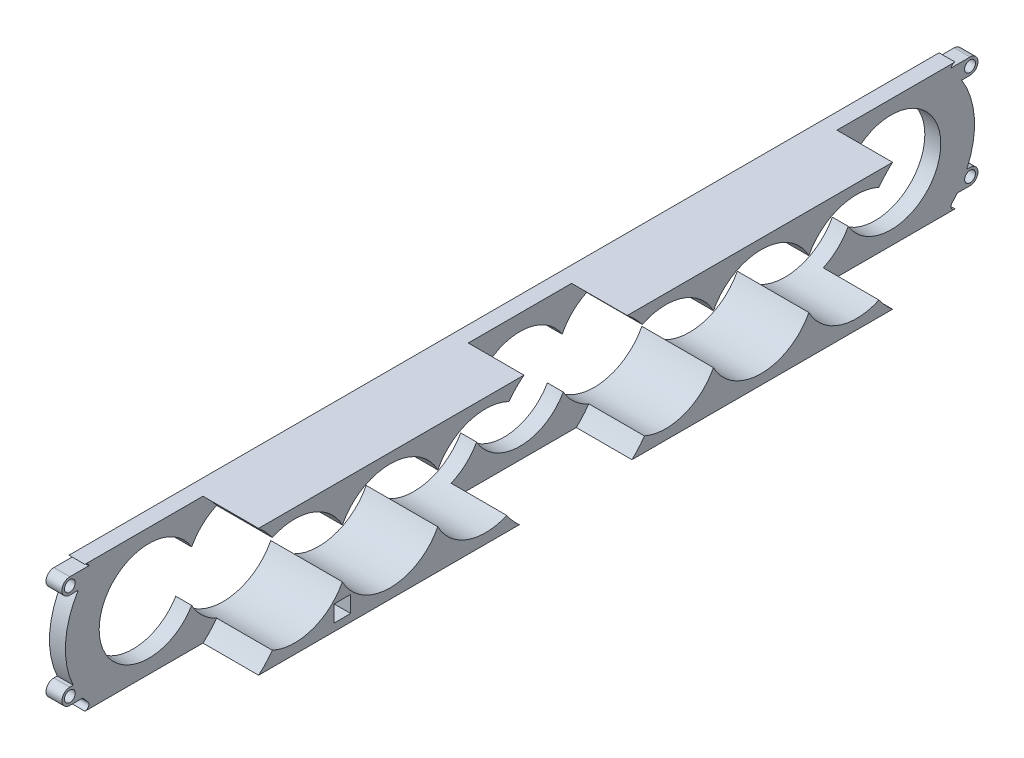
from build123d import *

# Parameters (mm, degrees)
SKETCH1_W           = 368.3
SKETCH1_H           = 50.8
BOSS_EXTRUDE1_DEPTH = 28.575
CHAMFER1_SIZE       = 6.35
FILLET1_R           = 3.175
SKETCH2_R           = 33.3375
CUT_EXTRUDE1_DEPTH  = 22.225
CUT_EXTRUDE2_REACH  = 190.186
CUT_EXTRUDE3_REACH  = 190.186
SKETCH5_W           = 6.604
SKETCH5_H           = 6.604
FILLET2_R           = 1.5875
CAVITY1_START       = 6.35
CAVITY1_OUTLINE_R   = 1.905
CAVITY1_DEPTH       = 22.225
CAVITY1_2_DEPTH     = 6.35
CUT_EXTRUDE4_REACH  = 188.943
SKETCH7_R           = 2.159


# Read off the part's stored shape, not the designer's step: Cavity1
with BuildPart() as part:
    # Sketch1 → Boss-Extrude1 (new body)
    with BuildSketch(Plane(origin=(0, 0, 0), x_dir=(0, 0, -1), z_dir=(1, 0, 0))):
        with Locations((0, 0.79375)):
            Rectangle(SKETCH1_W, SKETCH1_H)
    extrude(amount=BOSS_EXTRUDE1_DEPTH)

    # Chamfer1
    chamfer1_edges = [part.edges().sort_by_distance(p)[0] for p in [
        (14.2875, -24.60625, 184.15),
        (14.2875, -24.60625, -184.15),
    ]]
    chamfer(chamfer1_edges, length=CHAMFER1_SIZE)

    # Fillet1
    fillet1_edges = [part.edges().sort_by_distance(p)[0] for p in [
        (14.2875, -18.25625, -184.15),
        (14.2875, -24.60625, 177.8),
        (14.2875, -24.60625, -177.8),
        (14.2875, -18.25625, 184.15),
        (14.2875, 26.19375, 184.15),
        (14.2875, 26.19375, -184.15),
    ]]
    fillet(fillet1_edges, radius=FILLET1_R)

    # Sketch2 → Cut-Extrude1 (cut)
    with BuildSketch(Plane(origin=(28.575, 0, 0), x_dir=(0, 0, -1), z_dir=(1, 0, 0))):
        with Locations((-148.157911006, 0.79375)):
            Circle(SKETCH2_R)
        Circle(SKETCH2_R)
        with Locations((148.157911006, 0.79375)):
            Circle(SKETCH2_R)
    extrude(amount=-CUT_EXTRUDE1_DEPTH, mode=Mode.SUBTRACT)

    # Sketch4 → Cut-Extrude2 (cut, up to next)
    with BuildSketch(Plane(origin=(28.575, 0, 0), x_dir=(0, 0, -1), z_dir=(1, 0, 0)), mode=Mode.PRIVATE) as cut_extrude2_sk1:
        with BuildLine():
            ThreePointArc((-131.07672228, 10.893621573), (-168.001661006, 0.79375), (-131.07672228, -9.306121573))
            ThreePointArc((-131.07672228, -9.306121573), (-112.015493633, -20.636909552), (-93.124577673, -9.024395271))
            ThreePointArc((-93.124577673, -9.024395271), (-74.074577673, -20.6375), (-55.024577673, -9.024395271))
            ThreePointArc((-55.024577673, -9.024395271), (-36.370033983, -20.633851146), (-17.299823722, -9.720623089))
            ThreePointArc((-17.299823722, -9.720623089), (0, -19.84375), (17.299823722, -9.720623089))
            ThreePointArc((17.299823722, -9.720623089), (36.370033983, -20.633851146), (55.024577673, -9.024395271))
            ThreePointArc((55.024577673, -9.024395271), (74.074577673, -20.6375), (93.124577673, -9.024395271))
            ThreePointArc((93.124577673, -9.024395271), (112.015493633, -20.636909552), (131.07672228, -9.306121573))
            ThreePointArc((131.07672228, -9.306121573), (168.001661006, 0.79375), (131.07672228, 10.893621573))
            ThreePointArc((131.07672228, 10.893621573), (112.015493633, 22.224409552), (93.124577673, 10.611895271))
            ThreePointArc((93.124577673, 10.611895271), (74.074577673, 22.225), (55.024577673, 10.611895271))
            ThreePointArc((55.024577673, 10.611895271), (35.897270086, 22.224860566), (16.854241153, 10.474204945))
            ThreePointArc((16.854241153, 10.474204945), (0, 19.84375), (-16.854241153, 10.474204945))
            ThreePointArc((-16.854241153, 10.474204945), (-35.897270086, 22.224860566), (-55.024577673, 10.611895271))
            ThreePointArc((-55.024577673, 10.611895271), (-74.074577673, 22.225), (-93.124577673, 10.611895271))
            ThreePointArc((-93.124577673, 10.611895271), (-112.015493633, 22.224409552), (-131.07672228, 10.893621573))
        make_face()
    cut_extrude2_tool1 = extrude(cut_extrude2_sk1.sketch, amount=-CUT_EXTRUDE2_REACH, mode=Mode.PRIVATE) & part.part
    add(cut_extrude2_tool1.solids().sort_by_distance((28.575, 0.715797, 0))[0], mode=Mode.SUBTRACT)

    # Sketch5 → Cut-Extrude3 (cut, up to next)
    with BuildSketch(Plane(origin=(28.575, 0, 0), x_dir=(0, 0, -1), z_dir=(1, 0, 0)), mode=Mode.PRIVATE) as cut_extrude3_sk1:
        with Locations((-93.124577673, -18.322281394)):
            Rectangle(SKETCH5_W, SKETCH5_H)
    cut_extrude3_tool1 = extrude(cut_extrude3_sk1.sketch, amount=-CUT_EXTRUDE3_REACH, mode=Mode.PRIVATE) & part.part
    add(cut_extrude3_tool1.solids().sort_by_distance((28.575, -18.322281, 93.124578))[0], mode=Mode.SUBTRACT)

    # Fillet2
    fillet2_edges = [part.edges().sort_by_distance(p)[0] for p in [
        (17.4625, -24.60625, -169.750245438),
        (17.4625, 26.19375, -169.750245438),
        (17.4625, -24.60625, 169.750245438),
        (17.4625, 26.19375, 169.750245438),
    ]]
    fillet(fillet2_edges, radius=FILLET2_R)

    # Cavity1 outline → Cavity1 (cut)
    # profile 1 of 2: a face of its own
    with BuildSketch(Plane.YZ.offset(CAVITY1_START)):
        with BuildLine():
            ThreePointArc((-21.936363636, 172.545014982), (-20.786227921, 173.568410001), (-19.590070715, 174.537614554))
            ThreePointArc((-19.590070715, 174.537614554), (-16.522960019, 176.64510919), (-13.240070715, 178.397632936))
            ThreePointArc((-13.240070715, 178.397632936), (2.926403377, 181.427126443), (18.57375, 176.358274589))
            ThreePointArc((18.57375, 176.358274589), (21.138345447, 174.567877729), (23.523863636, 172.545014982))
            ThreePointArc((23.523863636, 172.545014982), (24.176019306, 172.178216056), (24.92375, 172.150879661))
            ThreePointArc((24.92375, 172.150879661), (25.835922212, 172.70228249), (26.19375, 173.706305647))
            Line((26.19375, 173.706305647), (26.19375, 180.975))
            ThreePointArc((26.19375, 180.975), (25.26381403, 183.22006403), (23.01875, 184.15))
            Line((23.01875, 184.15), (-16.941121939, 184.15))
            ThreePointArc((-16.941121939, 184.15), (-18.156141837, 183.908317516), (-19.18618597, 183.22006403))
            Line((-19.18618597, 183.22006403), (-23.67631403, 178.72993597))
            ThreePointArc((-23.67631403, 178.72993597), (-24.364567516, 177.699891837), (-24.60625, 176.484871939))
            Line((-24.60625, 176.484871939), (-24.60625, 173.706305647))
            ThreePointArc((-24.60625, 173.706305647), (-23.651943453, 172.250550757), (-21.936363636, 172.545014982))
        make_face()
        with Locations((-16.415070715, 179.705)):
            Circle(CAVITY1_OUTLINE_R, mode=Mode.SUBTRACT)
        with Locations((21.74875, 179.705)):
            Circle(CAVITY1_OUTLINE_R, mode=Mode.SUBTRACT)
    # profile 2 of 2: a face of its own
    with BuildSketch(Plane.YZ.offset(CAVITY1_START)):
        with BuildLine():
            ThreePointArc((-21.936363636, -172.545014982), (-23.651943453, -172.250550757), (-24.60625, -173.706305647))
            Line((-24.60625, -173.706305647), (-24.60625, -176.484871939))
            ThreePointArc((-24.60625, -176.484871939), (-24.364567516, -177.699891837), (-23.67631403, -178.72993597))
            Line((-23.67631403, -178.72993597), (-19.18618597, -183.22006403))
            ThreePointArc((-19.18618597, -183.22006403), (-18.156141837, -183.908317516), (-16.941121939, -184.15))
            Line((-16.941121939, -184.15), (23.01875, -184.15))
            ThreePointArc((23.01875, -184.15), (25.26381403, -183.22006403), (26.19375, -180.975))
            Line((26.19375, -180.975), (26.19375, -173.706305647))
            ThreePointArc((26.19375, -173.706305647), (25.835922212, -172.70228249), (24.92375, -172.150879661))
            ThreePointArc((24.92375, -172.150879661), (24.176019306, -172.178216056), (23.523863636, -172.545014982))
            ThreePointArc((23.523863636, -172.545014982), (21.138345447, -174.567877729), (18.57375, -176.358274589))
            ThreePointArc((18.57375, -176.358274589), (2.926403377, -181.427126443), (-13.240070715, -178.397632935))
            ThreePointArc((-13.240070715, -178.397632935), (-16.522960019, -176.64510919), (-19.590070715, -174.537614554))
            ThreePointArc((-19.590070715, -174.537614554), (-20.786227921, -173.568410001), (-21.936363636, -172.545014982))
        make_face()
        with Locations((-16.415070715, -179.705)):
            Circle(CAVITY1_OUTLINE_R, mode=Mode.SUBTRACT)
        with Locations((21.74875, -179.705)):
            Circle(CAVITY1_OUTLINE_R, mode=Mode.SUBTRACT)
    extrude(amount=CAVITY1_DEPTH, mode=Mode.SUBTRACT)

    # Cavity1 2 outline → Cavity1 2 (cut)
    with BuildSketch(Plane.YZ):
        with BuildLine():
            Line((-13.240070715, 179.705), (-13.240070715, 178.397632935))
            ThreePointArc((-13.240070715, 178.397632935), (2.926403377, 181.427126443), (18.57375, 176.358274589))
            Line((18.57375, 176.358274589), (18.57375, 179.705))
            ThreePointArc((18.57375, 179.705), (21.74875, 182.88), (24.92375, 179.705))
            Line((24.92375, 179.705), (24.92375, 172.150879661))
            ThreePointArc((24.92375, 172.150879661), (25.835922212, 172.70228249), (26.19375, 173.706305647))
            Line((26.19375, 173.706305647), (26.19375, 180.975))
            ThreePointArc((26.19375, 180.975), (25.26381403, 183.22006403), (23.01875, 184.15))
            Line((23.01875, 184.15), (-16.941121939, 184.15))
            ThreePointArc((-16.941121939, 184.15), (-18.156141837, 183.908317516), (-19.18618597, 183.22006403))
            Line((-19.18618597, 183.22006403), (-23.67631403, 178.72993597))
            ThreePointArc((-23.67631403, 178.72993597), (-24.364567516, 177.699891837), (-24.60625, 176.484871939))
            Line((-24.60625, 176.484871939), (-24.60625, 173.706305647))
            ThreePointArc((-24.60625, 173.706305647), (-23.651943453, 172.250550757), (-21.936363636, 172.545014982))
            ThreePointArc((-21.936363636, 172.545014982), (-20.786227921, 173.568410001), (-19.590070715, 174.537614554))
            Line((-19.590070715, 174.537614554), (-19.590070715, 179.705))
            ThreePointArc((-19.590070715, 179.705), (-16.415070715, 182.88), (-13.240070715, 179.705))
        make_face()
        with BuildLine():
            ThreePointArc((-21.936363636, -172.545014982), (-23.651943453, -172.250550757), (-24.60625, -173.706305647))
            Line((-24.60625, -173.706305647), (-24.60625, -176.484871939))
            ThreePointArc((-24.60625, -176.484871939), (-24.364567516, -177.699891837), (-23.67631403, -178.72993597))
            Line((-23.67631403, -178.72993597), (-19.18618597, -183.22006403))
            ThreePointArc((-19.18618597, -183.22006403), (-18.156141837, -183.908317516), (-16.941121939, -184.15))
            Line((-16.941121939, -184.15), (23.01875, -184.15))
            ThreePointArc((23.01875, -184.15), (25.26381403, -183.22006403), (26.19375, -180.975))
            Line((26.19375, -180.975), (26.19375, -173.706305647))
            ThreePointArc((26.19375, -173.706305647), (25.835922212, -172.70228249), (24.92375, -172.150879661))
            Line((24.92375, -172.150879661), (24.92375, -179.705))
            ThreePointArc((24.92375, -179.705), (21.74875, -182.88), (18.57375, -179.705))
            Line((18.57375, -179.705), (18.57375, -176.358274589))
            ThreePointArc((18.57375, -176.358274589), (2.926403377, -181.427126443), (-13.240070715, -178.397632935))
            Line((-13.240070715, -178.397632935), (-13.240070715, -179.705))
            ThreePointArc((-13.240070715, -179.705), (-16.415070715, -182.88), (-19.590070715, -179.705))
            Line((-19.590070715, -179.705), (-19.590070715, -174.537614554))
            ThreePointArc((-19.590070715, -174.537614554), (-20.786227921, -173.568410001), (-21.936363636, -172.545014982))
        make_face()
    extrude(amount=CAVITY1_2_DEPTH, mode=Mode.SUBTRACT)

    # Sketch7 → Cut-Extrude4 (cut, up to next)
    with BuildSketch(Plane(origin=(28.575, 0, 0), x_dir=(0, 0, -1), z_dir=(1, 0, 0)), mode=Mode.PRIVATE) as cut_extrude4_sk1:
        with Locations((-179.705, 21.74875)):
            Circle(SKETCH7_R)
    cut_extrude4_tool1 = extrude(cut_extrude4_sk1.sketch, amount=-CUT_EXTRUDE4_REACH, mode=Mode.PRIVATE) & part.part
    # Sketch7 → Cut-Extrude4 (cut, up to next)
    with BuildSketch(Plane(origin=(28.575, 0, 0), x_dir=(0, 0, -1), z_dir=(1, 0, 0)), mode=Mode.PRIVATE) as cut_extrude4_sk2:
        with Locations((-179.705, -16.415070715)):
            Circle(SKETCH7_R)
    cut_extrude4_tool2 = extrude(cut_extrude4_sk2.sketch, amount=-CUT_EXTRUDE4_REACH, mode=Mode.PRIVATE) & part.part
    # Sketch7 → Cut-Extrude4 (cut, up to next)
    with BuildSketch(Plane(origin=(28.575, 0, 0), x_dir=(0, 0, -1), z_dir=(1, 0, 0)), mode=Mode.PRIVATE) as cut_extrude4_sk3:
        with Locations((179.705, 21.74875)):
            Circle(SKETCH7_R)
    cut_extrude4_tool3 = extrude(cut_extrude4_sk3.sketch, amount=-CUT_EXTRUDE4_REACH, mode=Mode.PRIVATE) & part.part
    # Sketch7 → Cut-Extrude4 (cut, up to next)
    with BuildSketch(Plane(origin=(28.575, 0, 0), x_dir=(0, 0, -1), z_dir=(1, 0, 0)), mode=Mode.PRIVATE) as cut_extrude4_sk4:
        with Locations((179.705, -16.415070715)):
            Circle(SKETCH7_R)
    cut_extrude4_tool4 = extrude(cut_extrude4_sk4.sketch, amount=-CUT_EXTRUDE4_REACH, mode=Mode.PRIVATE) & part.part
    add(cut_extrude4_tool1.solids().sort_by_distance((28.575, 21.74875, 179.705))[0], mode=Mode.SUBTRACT)
    add(cut_extrude4_tool2.solids().sort_by_distance((28.575, -16.415071, 179.705))[0], mode=Mode.SUBTRACT)
    add(cut_extrude4_tool3.solids().sort_by_distance((28.575, 21.74875, -179.705))[0], mode=Mode.SUBTRACT)
    add(cut_extrude4_tool4.solids().sort_by_distance((28.575, -16.415071, -179.705))[0], mode=Mode.SUBTRACT)


solid = part.part
